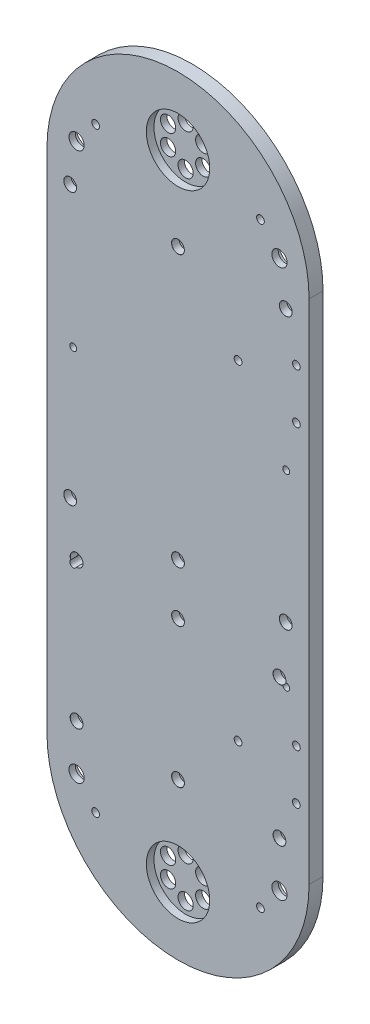
from build123d import *

# Parameters (mm, degrees)
SKETCH_2_W                      = 103.347185053
SKETCH_2_H                      = 200
EXTRUDE_1_DEPTH                 = 5.5
EXTRUDE_START                   = -5.5
EXTRUDE_2_OUTLINE_R             = 3
EXTRUDE_2_DEPTH                 = 5.5
CUT_EXTRUDE_START               = -3
CUT_EXTRUDE_6_OUTLINE_R         = 12.5
CUT_EXTRUDE_6_OUTLINE_R_2       = 3
CUT_EXTRUDE_6_DEPTH             = 3
CUT_EXTRUDE3_START              = -5.5
CUT_EXTRUDE3_OUTLINE_R          = 6
CUT_EXTRUDE3_OUTLINE_R_2        = 3
CUT_EXTRUDE3_DEPTH              = 3
CUT_EXTRUDE_7_DEPTH             = 5
HOLE_WIZARD_3_100_2_D           = 3.048
HOLE_WIZARD_3_100_2_CSINK_D     = 5.0546
HOLE_WIZARD_3_100_2_CSINK_ANGLE = 100
HOLE_WIZARD_1_AT_2_COUNT        = 2
HOLE_WIZARD_1_AT_2_PITCH        = 42.5
HOLE_WIZARD_1_AT_3_COUNT        = 2
HOLE_WIZARD_1_AT_3_PITCH        = 85
HOLE_WIZARD_1_AT_4_COUNT        = 2
HOLE_WIZARD_1_AT_4_PITCH        = 107
HOLE_WIZARD_1_AT_5_COUNT        = 2
HOLE_WIZARD_1_AT_5_PITCH        = 115.131446616
HOLE_WIZARD_1_AT_6_COUNT        = 2
HOLE_WIZARD_1_AT_6_PITCH        = 136.65284483
HOLE_WIZARD_2_AT_2_COUNT        = 2
HOLE_WIZARD_2_AT_2_PITCH        = 40
HOLE_WIZARD_2_AT_3_COUNT        = 2
HOLE_WIZARD_2_AT_3_PITCH        = 55
HOLE_WIZARD_2_AT_4_COUNT        = 2
HOLE_WIZARD_2_AT_4_PITCH        = 68.007352544
HOLE_WIZARD_2_AT_5_COUNT        = 2
HOLE_WIZARD_2_AT_5_PITCH        = 97.082439195
HOLE_WIZARD_2_AT_6_COUNT        = 2
HOLE_WIZARD_2_AT_6_PITCH        = 80
SKETCH_15_R                     = 1.525
CUT_EXTRUDE_8_DEPTH             = 5.5


# Read off the part's stored shape, not the designer's step: 凸台-拉伸2, 切除-拉伸6, Cut-Extrude3
with BuildPart() as part:
    # 草图2 → 凸台-拉伸1 (new body)
    with BuildSketch(Plane.XY):
        with Locations((35.726375018, 3.508914385)):
            Rectangle(SKETCH_2_W, SKETCH_2_H)
    extrude(amount=EXTRUDE_1_DEPTH)

    # 凸台-拉伸2 outline → 凸台-拉伸2 (add)
    # profile 1 of 2: a face of its own
    with BuildSketch(Plane.XY.offset(5.5).offset(EXTRUDE_START)):
        with BuildLine():
            Line((-15.947217509, 103.508914385), (87.399967544, 103.508914385))
            ThreePointArc((87.399967544, 103.508914385), (35.726375017, 155.182506912), (-15.947217509, 103.508914385))
        make_face()
        with Locations((-4.273624983, 111.508914385)):
            Circle(EXTRUDE_2_OUTLINE_R, mode=Mode.SUBTRACT)
        with Locations((28.798171787, 124.508914385)):
            Circle(EXTRUDE_2_OUTLINE_R, mode=Mode.SUBTRACT)
        with Locations((28.798171787, 132.508914385)):
            Circle(EXTRUDE_2_OUTLINE_R, mode=Mode.SUBTRACT)
        with Locations((35.726375017, 120.508914385)):
            Circle(EXTRUDE_2_OUTLINE_R, mode=Mode.SUBTRACT)
        with Locations((35.726375017, 136.508914385)):
            Circle(EXTRUDE_2_OUTLINE_R, mode=Mode.SUBTRACT)
        with Locations((42.654578248, 124.508914385)):
            Circle(EXTRUDE_2_OUTLINE_R, mode=Mode.SUBTRACT)
        with Locations((42.654578248, 132.508914385)):
            Circle(EXTRUDE_2_OUTLINE_R, mode=Mode.SUBTRACT)
        with Locations((75.726375017, 111.508914385)):
            Circle(EXTRUDE_2_OUTLINE_R, mode=Mode.SUBTRACT)
    # profile 2 of 2: a face of its own
    with BuildSketch(Plane.XY.offset(5.5).offset(EXTRUDE_START)):
        with BuildLine():
            Line((87.399967544, -96.491085615), (-15.947217509, -96.491085615))
            ThreePointArc((-15.947217509, -96.491085615), (35.726375018, -148.164678141), (87.399967544, -96.491085615))
        make_face()
        with Locations((-4.273624983, -104.491085615)):
            Circle(EXTRUDE_2_OUTLINE_R, mode=Mode.SUBTRACT)
        with Locations((35.726375017, -129.491085615)):
            Circle(EXTRUDE_2_OUTLINE_R, mode=Mode.SUBTRACT)
        with Locations((28.798171787, -125.491085615)):
            Circle(EXTRUDE_2_OUTLINE_R, mode=Mode.SUBTRACT)
        with Locations((28.798171787, -117.491085615)):
            Circle(EXTRUDE_2_OUTLINE_R, mode=Mode.SUBTRACT)
        with Locations((35.726375017, -113.491085615)):
            Circle(EXTRUDE_2_OUTLINE_R, mode=Mode.SUBTRACT)
        with Locations((42.654578248, -125.491085615)):
            Circle(EXTRUDE_2_OUTLINE_R, mode=Mode.SUBTRACT)
        with Locations((42.654578248, -117.491085615)):
            Circle(EXTRUDE_2_OUTLINE_R, mode=Mode.SUBTRACT)
        with Locations((75.726375017, -104.491085615)):
            Circle(EXTRUDE_2_OUTLINE_R, mode=Mode.SUBTRACT)
    extrude(amount=EXTRUDE_2_DEPTH)

    # 切除-拉伸6 outline → 切除-拉伸6 (cut)
    # profile 1 of 2: a face of its own
    with BuildSketch(Plane.XY.offset(5.5).offset(CUT_EXTRUDE_START)):
        with Locations((35.726375017, -121.491085615)):
            Circle(CUT_EXTRUDE_6_OUTLINE_R)
        with Locations((28.798171787, -125.491085615)):
            Circle(CUT_EXTRUDE_6_OUTLINE_R_2, mode=Mode.SUBTRACT)
        with Locations((28.798171787, -117.491085615)):
            Circle(CUT_EXTRUDE_6_OUTLINE_R_2, mode=Mode.SUBTRACT)
        with Locations((35.726375017, -129.491085615)):
            Circle(CUT_EXTRUDE_6_OUTLINE_R_2, mode=Mode.SUBTRACT)
        with Locations((35.726375017, -113.491085615)):
            Circle(CUT_EXTRUDE_6_OUTLINE_R_2, mode=Mode.SUBTRACT)
        with Locations((42.654578248, -125.491085615)):
            Circle(CUT_EXTRUDE_6_OUTLINE_R_2, mode=Mode.SUBTRACT)
        with Locations((42.654578248, -117.491085615)):
            Circle(CUT_EXTRUDE_6_OUTLINE_R_2, mode=Mode.SUBTRACT)
    # profile 2 of 2: a face of its own
    with BuildSketch(Plane.XY.offset(5.5).offset(CUT_EXTRUDE_START)):
        with Locations((35.726375017, 128.508914385)):
            Circle(CUT_EXTRUDE_6_OUTLINE_R)
        with Locations((28.798171787, 124.508914385)):
            Circle(CUT_EXTRUDE_6_OUTLINE_R_2, mode=Mode.SUBTRACT)
        with Locations((28.798171787, 132.508914385)):
            Circle(CUT_EXTRUDE_6_OUTLINE_R_2, mode=Mode.SUBTRACT)
        with Locations((35.726375017, 120.508914385)):
            Circle(CUT_EXTRUDE_6_OUTLINE_R_2, mode=Mode.SUBTRACT)
        with Locations((35.726375017, 136.508914385)):
            Circle(CUT_EXTRUDE_6_OUTLINE_R_2, mode=Mode.SUBTRACT)
        with Locations((42.654578248, 124.508914385)):
            Circle(CUT_EXTRUDE_6_OUTLINE_R_2, mode=Mode.SUBTRACT)
        with Locations((42.654578248, 132.508914385)):
            Circle(CUT_EXTRUDE_6_OUTLINE_R_2, mode=Mode.SUBTRACT)
    extrude(amount=CUT_EXTRUDE_6_DEPTH, mode=Mode.SUBTRACT)

    # Cut-Extrude3 outline → Cut-Extrude3 (cut)
    # profile 1 of 4: a face of its own
    with BuildSketch(Plane.XY.offset(5.5).offset(CUT_EXTRUDE3_START)):
        with Locations((75.726375017, -104.491085615)):
            Circle(CUT_EXTRUDE3_OUTLINE_R)
        with Locations((75.726375017, -104.491085615)):
            Circle(CUT_EXTRUDE3_OUTLINE_R_2, mode=Mode.SUBTRACT)
    # profile 2 of 4: a face of its own
    with BuildSketch(Plane.XY.offset(5.5).offset(CUT_EXTRUDE3_START)):
        with Locations((-4.273624983, -104.491085615)):
            Circle(CUT_EXTRUDE3_OUTLINE_R)
        with Locations((-4.273624983, -104.491085615)):
            Circle(CUT_EXTRUDE3_OUTLINE_R_2, mode=Mode.SUBTRACT)
    # profile 3 of 4: a face of its own
    with BuildSketch(Plane.XY.offset(5.5).offset(CUT_EXTRUDE3_START)):
        with Locations((75.726375017, 111.508914385)):
            Circle(CUT_EXTRUDE3_OUTLINE_R)
        with Locations((75.726375017, 111.508914385)):
            Circle(CUT_EXTRUDE3_OUTLINE_R_2, mode=Mode.SUBTRACT)
    # profile 4 of 4: a face of its own
    with BuildSketch(Plane.XY.offset(5.5).offset(CUT_EXTRUDE3_START)):
        with Locations((-4.273624983, 111.508914385)):
            Circle(CUT_EXTRUDE3_OUTLINE_R)
        with Locations((-4.273624983, 111.508914385)):
            Circle(CUT_EXTRUDE3_OUTLINE_R_2, mode=Mode.SUBTRACT)
    extrude(amount=CUT_EXTRUDE3_DEPTH, mode=Mode.SUBTRACT)

    # 草图5 → 切除-拉伸7 (cut)
    with BuildSketch(Plane.XY.offset(5.5)):
        with BuildLine():
            ThreePointArc((79.749967544, 40.508914385), (78.399967544, 41.858914385), (77.049967544, 40.508914385))
            Line((77.049967544, 40.508914385), (78.399967544, 40.508914385))
            Line((78.399967544, 40.508914385), (78.399967544, 39.158914385))
            ThreePointArc((78.399967544, 39.158914385), (79.354561699, 39.554320231), (79.749967544, 40.508914385))
        make_face()
        with BuildLine():
            Line((78.399967544, 40.508914385), (77.049967544, 40.508914385))
            ThreePointArc((77.049967544, 40.508914385), (77.44537339, 39.554320231), (78.399967544, 39.158914385))
            Line((78.399967544, 39.158914385), (78.399967544, 40.508914385))
        make_face()
        with BuildLine():
            ThreePointArc((79.749967544, -33.491085615), (79.354561699, -32.53649146), (78.399967544, -32.141085615))
            Line((78.399967544, -32.141085615), (78.399967544, -33.491085615))
            Line((78.399967544, -33.491085615), (77.049967544, -33.491085615))
            ThreePointArc((77.049967544, -33.491085615), (78.399967544, -34.841085615), (79.749967544, -33.491085615))
        make_face()
        with BuildLine():
            Line((78.399967544, -33.491085615), (78.399967544, -32.141085615))
            ThreePointArc((78.399967544, -32.141085615), (77.44537339, -32.53649146), (77.049967544, -33.491085615))
            Line((77.049967544, -33.491085615), (78.399967544, -33.491085615))
        make_face()
        with BuildLine():
            ThreePointArc((-4.250032456, -33.491085615), (-4.645438301, -32.53649146), (-5.600032456, -32.141085615))
            Line((-5.600032456, -32.141085615), (-5.600032456, -33.491085615))
            Line((-5.600032456, -33.491085615), (-4.250032456, -33.491085615))
        make_face()
        with BuildLine():
            Line((-5.600032456, -33.491085615), (-5.600032456, -32.141085615))
            ThreePointArc((-5.600032456, -32.141085615), (-6.55462661, -34.445679769), (-4.250032456, -33.491085615))
            Line((-4.250032456, -33.491085615), (-5.600032456, -33.491085615))
        make_face()
        with BuildLine():
            Line((-5.600032456, 39.158914385), (-5.600032456, 40.508914385))
            Line((-5.600032456, 40.508914385), (-4.250032456, 40.508914385))
            ThreePointArc((-4.250032456, 40.508914385), (-6.55462661, 41.46350854), (-5.600032456, 39.158914385))
        make_face()
        with BuildLine():
            Line((-4.250032456, 40.508914385), (-5.600032456, 40.508914385))
            Line((-5.600032456, 40.508914385), (-5.600032456, 39.158914385))
            ThreePointArc((-5.600032456, 39.158914385), (-4.645438301, 39.554320231), (-4.250032456, 40.508914385))
        make_face()
    extrude(amount=-CUT_EXTRUDE_7_DEPTH, mode=Mode.SUBTRACT)

    # #3 平头机械螺钉的锥形沉头孔 (100)2 (through all)
    with Locations(Plane(origin=(0, 0, 0), x_dir=(-1, 0, 0), z_dir=(0, 0, -1))):
        with Locations((-82.399967544, 78.358914385), (-59.399967544, 68.508914385), (-82.399967544, 58.658914385)):
            hole_wizard_3_100_2 = CounterSinkHole(HOLE_WIZARD_3_100_2_D / 2, HOLE_WIZARD_3_100_2_CSINK_D / 2, counter_sink_angle=HOLE_WIZARD_3_100_2_CSINK_ANGLE)

    # 镜向1: #3 平头机械螺钉的锥形沉头孔 (100)2 across plane
    add(hole_wizard_3_100_2.mirror(Plane.ZX.offset(3.51)), mode=Mode.SUBTRACT)

    # 草图12 → 打孔尺寸(%根据)内六角圆柱头螺钉的类型1 (revolve, cut)
    with BuildSketch(Plane(origin=(-6.800032456, 95.508914385, 5.5), x_dir=(0, -1, 0), z_dir=(1, 0, 0))):
        Polygon((0, 0), (0, 5.5), (1.55, 5.5), (1.55, 2.9), (2.5, 2.9), (2.5, 0.020977491), (2.525, 0), align=None)
    hole_wizard_1 = revolve(axis=Axis((-6.800032456, 95.508914385, 11.85), (0, 0, -1)), mode=Mode.SUBTRACT)

    # 打孔尺寸(%根据)内六角圆柱头螺钉的类型1 at 2: 打孔尺寸(%根据)内六角圆柱头螺钉的类型1 ×2
    with Locations(*[(i * HOLE_WIZARD_1_AT_2_PITCH, 0, 0) for i in range(1, HOLE_WIZARD_1_AT_2_COUNT)]):
        add(hole_wizard_1, mode=Mode.SUBTRACT)

    # 打孔尺寸(%根据)内六角圆柱头螺钉的类型1 at 3: 打孔尺寸(%根据)内六角圆柱头螺钉的类型1 ×2
    with Locations(*[(i * HOLE_WIZARD_1_AT_3_PITCH, 0, 0) for i in range(1, HOLE_WIZARD_1_AT_3_COUNT)]):
        add(hole_wizard_1, mode=Mode.SUBTRACT)

    # 打孔尺寸(%根据)内六角圆柱头螺钉的类型1 at 4: 打孔尺寸(%根据)内六角圆柱头螺钉的类型1 ×2
    with Locations(*[(0, -i * HOLE_WIZARD_1_AT_4_PITCH, 0) for i in range(1, HOLE_WIZARD_1_AT_4_COUNT)]):
        add(hole_wizard_1, mode=Mode.SUBTRACT)

    # 打孔尺寸(%根据)内六角圆柱头螺钉的类型1 at 5: 打孔尺寸(%根据)内六角圆柱头螺钉的类型1 ×2
    with Locations(*[Vector(0.3691432814318687, -0.9293724967814101, 0) * (i * HOLE_WIZARD_1_AT_5_PITCH) for i in range(1, HOLE_WIZARD_1_AT_5_COUNT)]):
        add(hole_wizard_1, mode=Mode.SUBTRACT)

    # 打孔尺寸(%根据)内六角圆柱头螺钉的类型1 at 6: 打孔尺寸(%根据)内六角圆柱头螺钉的类型1 ×2
    with Locations(*[Vector(0.6220141271558814, -0.7830060188903447, 0) * (i * HOLE_WIZARD_1_AT_6_PITCH) for i in range(1, HOLE_WIZARD_1_AT_6_COUNT)]):
        add(hole_wizard_1, mode=Mode.SUBTRACT)

    # 草图14 → 打孔尺寸(%根据)内六角圆柱头螺钉的类型2 (revolve, cut)
    with BuildSketch(Plane(origin=(-4.280032456, -31.491085615, 5.5), x_dir=(0, -1, 0), z_dir=(1, 0, 0))):
        Polygon((0, 0), (0, 5.5), (1.55, 5.5), (1.55, 2.9), (2.5, 2.9), (2.5, 0.020977491), (2.525, 0), align=None)
    hole_wizard_2 = revolve(axis=Axis((-4.280032456, -31.491085615, 11.85), (0, 0, -1)), mode=Mode.SUBTRACT)

    # 打孔尺寸(%根据)内六角圆柱头螺钉的类型2 at 2: 打孔尺寸(%根据)内六角圆柱头螺钉的类型2 ×2
    with Locations(*[(i * HOLE_WIZARD_2_AT_2_PITCH, 0, 0) for i in range(1, HOLE_WIZARD_2_AT_2_COUNT)]):
        add(hole_wizard_2, mode=Mode.SUBTRACT)

    # 打孔尺寸(%根据)内六角圆柱头螺钉的类型2 at 3: 打孔尺寸(%根据)内六角圆柱头螺钉的类型2 ×2
    with Locations(*[(0, -i * HOLE_WIZARD_2_AT_3_PITCH, 0) for i in range(1, HOLE_WIZARD_2_AT_3_COUNT)]):
        add(hole_wizard_2, mode=Mode.SUBTRACT)

    # 打孔尺寸(%根据)内六角圆柱头螺钉的类型2 at 4: 打孔尺寸(%根据)内六角圆柱头螺钉的类型2 ×2
    with Locations(*[Vector(0.5881716976750464, -0.8087360843031884, 0) * (i * HOLE_WIZARD_2_AT_4_PITCH) for i in range(1, HOLE_WIZARD_2_AT_4_COUNT)]):
        add(hole_wizard_2, mode=Mode.SUBTRACT)

    # 打孔尺寸(%根据)内六角圆柱头螺钉的类型2 at 5: 打孔尺寸(%根据)内六角圆柱头螺钉的类型2 ×2
    with Locations(*[Vector(0.8240419241993677, -0.5665288228870651, 0) * (i * HOLE_WIZARD_2_AT_5_PITCH) for i in range(1, HOLE_WIZARD_2_AT_5_COUNT)]):
        add(hole_wizard_2, mode=Mode.SUBTRACT)

    # 打孔尺寸(%根据)内六角圆柱头螺钉的类型2 at 6: 打孔尺寸(%根据)内六角圆柱头螺钉的类型2 ×2
    with Locations(*[(i * HOLE_WIZARD_2_AT_6_PITCH, 0, 0) for i in range(1, HOLE_WIZARD_2_AT_6_COUNT)]):
        add(hole_wizard_2, mode=Mode.SUBTRACT)

    # 草图15 → 切除-拉伸8 (cut)
    with BuildSketch(Plane.XY.offset(5.5)):
        with Locations((3.226375017, 121.008914385)):
            Circle(SKETCH_15_R)
        with Locations((68.226375017, 121.008914385)):
            Circle(SKETCH_15_R)
        with Locations((68.226375017, -113.991085615)):
            Circle(SKETCH_15_R)
        with Locations((3.226375017, -113.991085615)):
            Circle(SKETCH_15_R)
    extrude(amount=-CUT_EXTRUDE_8_DEPTH, mode=Mode.SUBTRACT)


solid = part.part
